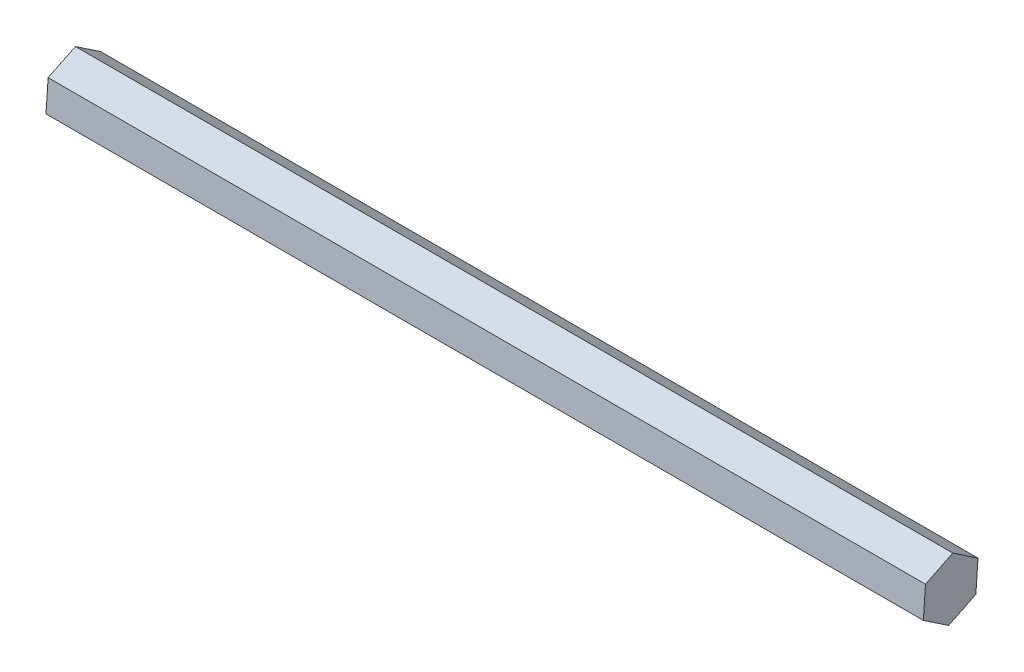
from build123d import *

# Parameters (mm, degrees)
BOSS_EXTRUDE1_DEPTH = 50


with BuildPart() as part:
    # Sketch1 → Boss-Extrude1 (new body)
    with BuildSketch(Plane(origin=(0, 0, 0), x_dir=(0, 0, -1), z_dir=(1, 0, 0))):
        Polygon((-1.435872184, 0.968643934), (-1.556806346, -0.759179821), (-0.120934162, -1.727823755), (1.435872184, -0.968643934), (1.556806346, 0.759179821), (0.120934162, 1.727823755), align=None)
    extrude(amount=BOSS_EXTRUDE1_DEPTH)


solid = part.part
